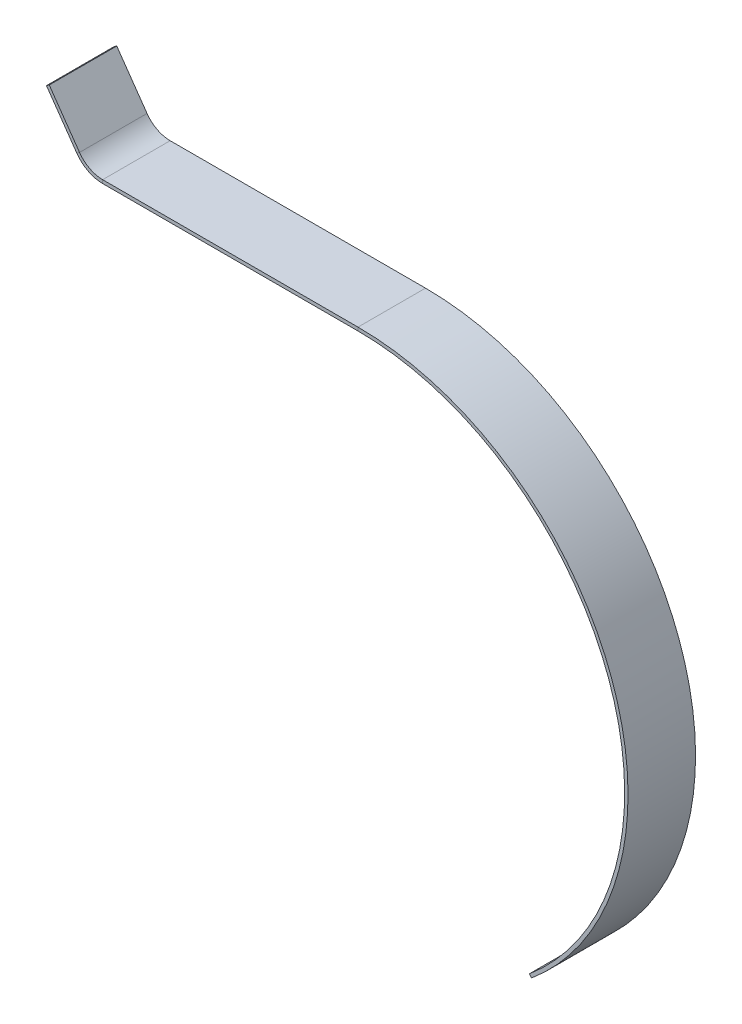
from build123d import *

# Parameters (mm, degrees)
BASE_FLANGE1_DEPTH = 2


# Sheet-metal steps are written as plain solids
with BuildPart() as part:
    # Sketch1 → Base-Flange1 (new body)
    with BuildSketch(Plane.XY):
        with BuildLine():
            Line((0, 0), (0.897356667, -1.281558135))
            ThreePointArc((0.897356667, -1.281558135), (1.196360377, -1.543777352), (1.582659267, -1.638304089))
            Line((1.582659267, -1.638304089), (9.147152873, -1.638304089))
            ThreePointArc((9.147152873, -1.638304089), (16.664693839, -6.902142942), (14.28945375, -15.766659634))
            Line((14.28945375, -15.766659634), (14.225174989, -15.690055189))
            ThreePointArc((14.225174989, -15.690055189), (16.570724577, -6.936344956), (9.147152873, -1.738304089))
            Line((9.147152873, -1.738304089), (1.582659267, -1.738304089))
            ThreePointArc((1.582659267, -1.738304089), (1.150185516, -1.632478435), (0.815441463, -1.338915779))
            Line((0.815441463, -1.338915779), (-0.081915204, -0.057357644))
            Line((-0.081915204, -0.057357644), (0, 0))
        make_face()
    extrude(amount=BASE_FLANGE1_DEPTH)


solid = part.part
